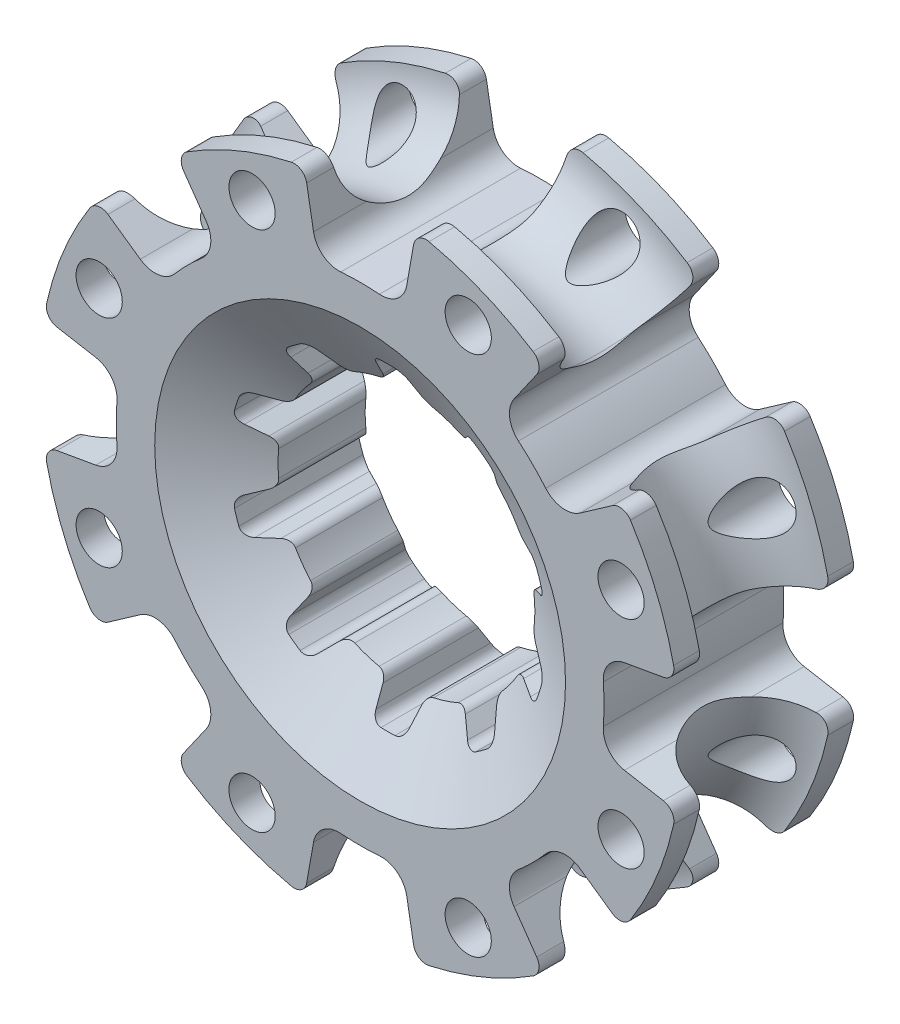
from build123d import *

# Parameters (mm, degrees)
SKETCH1_R           = 125
BOSS_EXTRUDE1_DEPTH = 70
CUT_EXTRUDE2_DEPTH  = 191.131533418
CIRPATTERN1_COUNT   = 8
SKETCH3_R           = 9
CUT_EXTRUDE3_DEPTH  = 187.463515406
CIRPATTERN2_COUNT   = 8
SKETCH4_R           = 25
SKETCH6_R           = 50
CUT_EXTRUDE5_DEPTH  = 187.463515609
CUT_EXTRUDE6_DEPTH  = 187.463515609
CIRPATTERN3_COUNT   = 10


with BuildPart() as part:
    # Sketch1 → Boss-Extrude1 (new body)
    with BuildSketch(Plane.XY):
        Circle(SKETCH1_R)
    extrude(amount=BOSS_EXTRUDE1_DEPTH)

    # Sketch2 → Cut-Extrude2 (cut, symmetric)
    with BuildSketch(Plane.XY.offset(70)):
        with BuildLine():
            Line((-603.08458473, -4.484776806), (-26.816379037, 122.089646635))
            ThreePointArc((-26.816379037, 122.089646635), (-22.961811272, 121.360692192), (-20.819685111, 118.074301657))
            Line((-20.819685111, 118.074301657), (-18.150180687, 102.934789751))
            ThreePointArc((-18.150180687, 102.934789751), (-14.42186229, 96.762507519), (-7.511426665, 94.702579001))
            ThreePointArc((-7.511426665, 94.702579001), (0, 95), (7.511426665, 94.702579001))
            ThreePointArc((7.511426665, 94.702579001), (14.42186229, 96.762507519), (18.150180687, 102.934789751))
            Line((18.150180687, 102.934789751), (20.819685111, 118.074301657))
            ThreePointArc((20.819685111, 118.074301657), (22.961811272, 121.360692192), (26.816379037, 122.089646635))
            Line((26.816379037, 122.089646635), (603.08458473, -4.484776806))
            Line((603.08458473, -4.484776806), (603.08458473, 1175.525612236))
            Line((603.08458473, 1175.525612236), (-603.08458473, 1175.525612236))
            Line((-603.08458473, 1175.525612236), (-603.08458473, -4.484776806))
        make_face()
    cut_extrude2 = extrude(amount=CUT_EXTRUDE2_DEPTH, both=True, mode=Mode.SUBTRACT)

    # CirPattern1: Cut-Extrude2 ×8 about axis
    cirpattern1_axis = Axis((0, 0, 70), (0, 0, 1))
    for i in range(1, CIRPATTERN1_COUNT):
        add(cut_extrude2.rotate(cirpattern1_axis, i * 360 / CIRPATTERN1_COUNT), mode=Mode.SUBTRACT)

    # Sketch3 → Cut-Extrude3 (cut, through all)
    with BuildSketch(Plane.XY.offset(70)):
        with Locations((-42.09517756, 101.626748576)):
            Circle(SKETCH3_R)
    cut_extrude3 = extrude(amount=-CUT_EXTRUDE3_DEPTH, mode=Mode.SUBTRACT)

    # CirPattern2: Cut-Extrude3 ×8 about axis
    cirpattern2_axis = Axis((0, 0, 70), (0, 0, 1))
    for i in range(1, CIRPATTERN2_COUNT):
        add(cut_extrude3.rotate(cirpattern2_axis, i * 360 / CIRPATTERN2_COUNT), mode=Mode.SUBTRACT)

    # Cut-Sweep2: sweep along a path in Sketch5
    with BuildLine(Plane.XY.offset(35)) as cut_sweep2_path:
        CenterArc((0, 0), 110, 0, 360)
    # Sketch4 → Cut-Sweep2 (sweep, cut)
    with BuildSketch(Plane(origin=(0, 0, 0), x_dir=(0, 0, -1), z_dir=(0.8191520442889993, -0.5735764363510353, 0))):
        with Locations((-35, 124.895788083)):
            Circle(SKETCH4_R)
    sweep(path=cut_sweep2_path.line, mode=Mode.SUBTRACT)

    # Sketch6 → Cut-Extrude5 (cut, through all)
    with BuildSketch(Plane(origin=(0, 0, 0), x_dir=(-1, 0, 0), z_dir=(0, 0, -1))):
        Circle(SKETCH6_R)
    extrude(amount=-CUT_EXTRUDE5_DEPTH, mode=Mode.SUBTRACT)

    # Sketch7 → Cut-Extrude6 (cut, through all)
    with BuildSketch(Plane(origin=(0, 0, 0), x_dir=(-1, 0, 0), z_dir=(0, 0, -1))):
        with BuildLine():
            ThreePointArc((-2.722061303, 61.940216195), (-5.210396484, 60.927922998), (-6.497197807, 58.569811075))
            Line((-6.497197807, 58.569811075), (-7.51511338, 52.142945086))
            ThreePointArc((-7.51511338, 52.142945086), (-8.558153826, 50.021829182), (-10.61654328, 48.859891617))
            ThreePointArc((-10.61654328, 48.859891617), (0, 50), (10.61654328, 48.859891617))
            ThreePointArc((10.61654328, 48.859891617), (8.558153826, 50.021829182), (7.51511338, 52.142945086))
            Line((7.51511338, 52.142945086), (6.497197807, 58.569811075))
            ThreePointArc((6.497197807, 58.569811075), (5.210396484, 60.927922998), (2.722061303, 61.940216195))
            ThreePointArc((2.722061303, 61.940216195), (0, 62), (-2.722061303, 61.940216195))
        make_face()
    cut_extrude6 = extrude(amount=-CUT_EXTRUDE6_DEPTH, mode=Mode.SUBTRACT)

    # CirPattern3: Cut-Extrude6 ×10 about axis
    cirpattern3_axis = Axis((0, 0, 0), (0, 0, -1))
    for i in range(1, CIRPATTERN3_COUNT):
        add(cut_extrude6.rotate(cirpattern3_axis, i * 360 / CIRPATTERN3_COUNT), mode=Mode.SUBTRACT)

    # Cut-Extrude7 cone 1 section (through the dimple's axis) → Cut-Extrude7 (revolve, cut)
    with BuildSketch(Plane.YZ):
        Polygon((0, 0), (80, 0), (0, 48.068849522), align=None)
    revolve(axis=Axis((0, 0, 0), (0, 0, 1)), mode=Mode.SUBTRACT)

    # Cut-Extrude8 cone 1 section (through the dimple's axis) → Cut-Extrude8 (revolve, cut)
    with BuildSketch(Plane(origin=(0, 0, 70), x_dir=(0, -1, 0), z_dir=(1, 0, 0))):
        Polygon((0, 0), (80, 0), (0, 48.068849522), align=None)
    revolve(axis=Axis((0, 0, 70), (0, 0, -1)), mode=Mode.SUBTRACT)


solid = part.part
